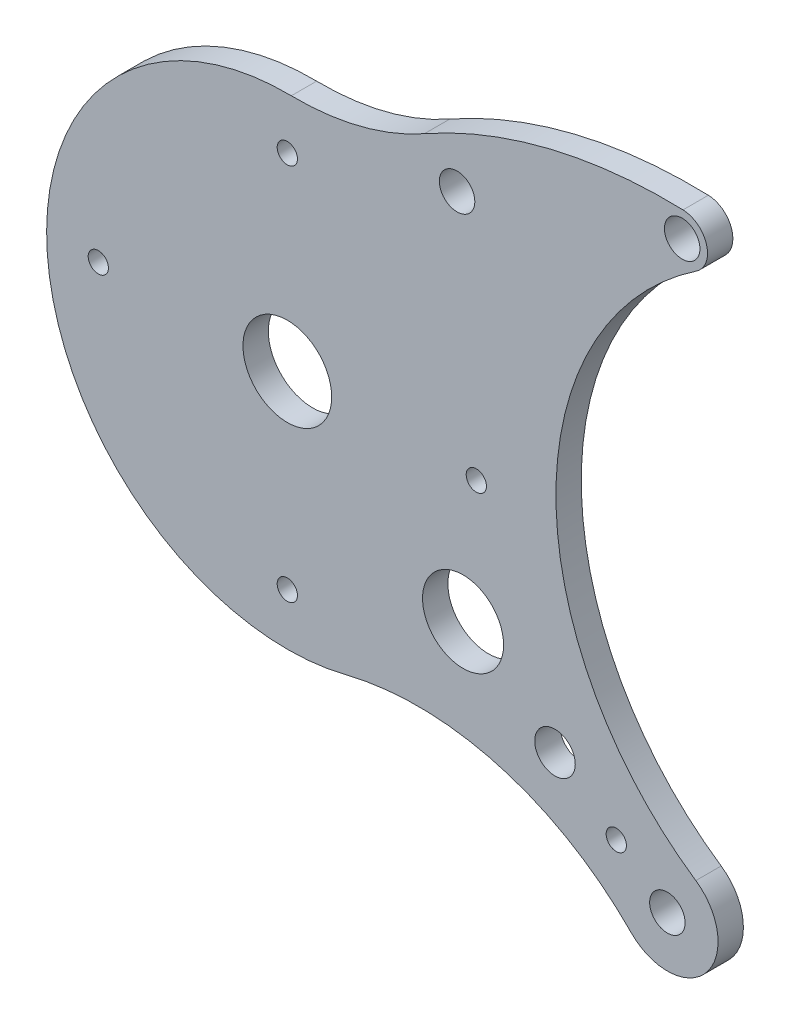
from build123d import *

# Parameters (mm, degrees)
SKETCH1_R           = 7
SKETCH1_R_2         = 4
SKETCH1_R_3         = 17.5
BOSS_EXTRUDE1_DEPTH = 10
SKETCH4_R           = 4
SKETCH4_R_2         = 8
SKETCH4_R_3         = 16
CUT_EXTRUDE1_DEPTH  = 217.313701829


with BuildPart() as part:
    # Sketch1 → Boss-Extrude1 (new body)
    with BuildSketch(Plane.XY):
        with BuildLine():
            ThreePointArc((1.572195793, 94.986989637), (-94.380567411, -10.83090463), (23.048944019, -92.161522229))
            ThreePointArc((23.048944019, -92.161522229), (83.617990825, -93.079348945), (135.711425994, -123.994164958))
            ThreePointArc((135.711425994, -123.994164958), (165.350102595, -122.820856068), (161.225161537, -93.447183066))
            ThreePointArc((161.225161537, -93.447183066), (106.014165413, 10.833093568), (161.441107802, 114.998751274))
            ThreePointArc((161.441107802, 114.998751274), (165.454566443, 126.056147345), (156.171848547, 133.281450563))
            ThreePointArc((156.171848547, 133.281450563), (103.433194213, 127.791254655), (54.122076862, 108.299676532))
            ThreePointArc((54.122076862, 108.299676532), (28.73316338, 98.145871106), (1.572195793, 94.986989637))
        make_face()
        with Locations((67, 95)):
            Circle(SKETCH1_R, mode=Mode.SUBTRACT)
        with Locations((155.845687485, 123.28677103)):
            Circle(SKETCH1_R, mode=Mode.SUBTRACT)
        with Locations((150, -110)):
            Circle(SKETCH1_R, mode=Mode.SUBTRACT)
        with Locations((0, 74.6)):
            Circle(SKETCH1_R_2, mode=Mode.SUBTRACT)
        with Locations((74.6, 0)):
            Circle(SKETCH1_R_2, mode=Mode.SUBTRACT)
        with Locations((0, -74.6)):
            Circle(SKETCH1_R_2, mode=Mode.SUBTRACT)
        with Locations((-74.6, 0)):
            Circle(SKETCH1_R_2, mode=Mode.SUBTRACT)
        Circle(SKETCH1_R_3, mode=Mode.SUBTRACT)
    extrude(amount=BOSS_EXTRUDE1_DEPTH)

    # Sketch4 → Cut-Extrude1 (cut, through all)
    with BuildSketch(Plane.XY.offset(10)):
        with Locations((129.839875104, -95.215908409)):
            Circle(SKETCH4_R)
        with Locations((105.647725228, -77.4749985)):
            Circle(SKETCH4_R_2)
        with Locations((69.359500414, -50.863633637)):
            Circle(SKETCH4_R_3)
    extrude(amount=-CUT_EXTRUDE1_DEPTH, mode=Mode.SUBTRACT)


solid = part.part
